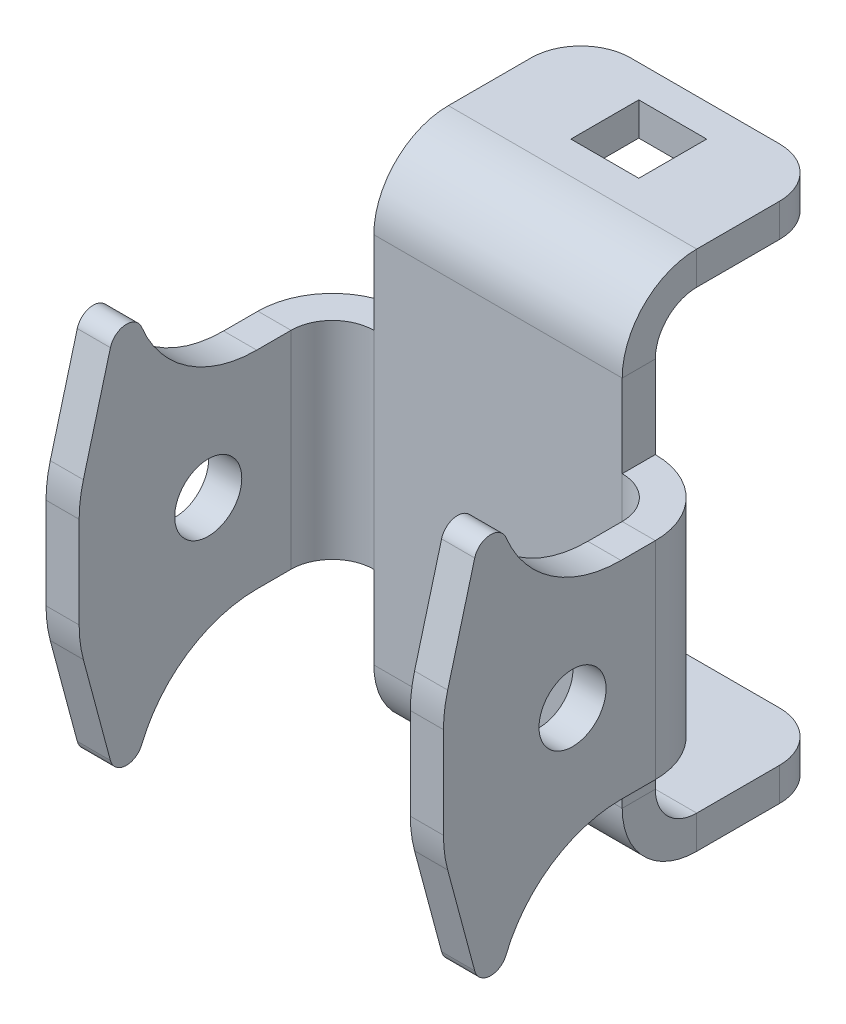
from build123d import *

# Parameters (mm, degrees)
SM_BASE_FLANGE_1_DEPTH      = 30
SM_EDGE_FLANGE_1_DEPTH      = 25
SM_EDGE_FLANGE_1_BEND_DEPTH = 25
SKETCH_10_R                 = 4.05
CUT_EXTRUDE_1_DEPTH         = 79.198465458
SKETCH_11_R                 = 4.05
CUT_EXTRUDE_2_DEPTH         = 84.054199171
FILLET_1_R                  = 6
SKETCH_12_W                 = 8.2
SKETCH_12_H                 = 8.2
CUT_EXTRUDE_3_DEPTH         = 4
SM_BASE_FLANGE_1_2_DEPTH    = 4
SM_BASE_FLANGE_2_DEPTH      = 4
FILLET_2_R                  = 15
FILLET_3_R                  = 2


# Sheet-metal steps are written as plain solids
with BuildPart() as part:
    # Sketch 1 → Sm Base Flange 1 (new body)
    with BuildSketch(Plane(origin=(0, 0, 0), x_dir=(0, 0, -1), z_dir=(1, 0, 0))):
        with BuildLine():
            Line((25, -63), (9, -63))
            ThreePointArc((9, -63), (2.636038969, -60.363961031), (0, -54))
            Line((0, -54), (0, -9))
            ThreePointArc((0, -9), (2.636038969, -2.636038969), (9, 0))
            Line((9, 0), (25, 0))
            Line((25, 0), (25, -4))
            Line((25, -4), (9, -4))
            ThreePointArc((9, -4), (5.464466094, -5.464466094), (4, -9))
            Line((4, -9), (4, -54))
            ThreePointArc((4, -54), (5.464466094, -57.535533906), (9, -59))
            Line((9, -59), (25, -59))
            Line((25, -59), (25, -63))
        make_face()
    extrude(amount=SM_BASE_FLANGE_1_DEPTH)

    # Ребро-кромка1 section (across the edge) → Ребро-кромка1 (add)
    with BuildSketch(Plane(origin=(-5, -19, 0), x_dir=(1, 0, 0), z_dir=(0, -1, 0))):
        with BuildLine():
            Line((-4, 5), (-4, 25))
            Line((-4, 25), (0, 25))
            Line((0, 25), (0, 5))
            ThreePointArc((0, 5), (1.464466094, 1.464466094), (5, 0))
            Line((5, 0), (5, -4))
            ThreePointArc((5, -4), (-1.363961031, -1.363961031), (-4, 5))
        make_face()
    extrude(amount=SM_EDGE_FLANGE_1_DEPTH)

    # Ребро-кромка1 section 2 (across the edge) → Ребро-кромка1 bend (add)
    with BuildSketch(Plane(origin=(35, -44, 0), x_dir=(-1, 0, 0), z_dir=(0, 1, 0))):
        with BuildLine():
            Line((-4, 5), (-4, 25))
            Line((-4, 25), (0, 25))
            Line((0, 25), (0, 5))
            ThreePointArc((0, 5), (1.464466094, 1.464466094), (5, 0))
            Line((5, 0), (5, -4))
            ThreePointArc((5, -4), (-1.363961031, -1.363961031), (-4, 5))
        make_face()
    extrude(amount=SM_EDGE_FLANGE_1_BEND_DEPTH)

    # Эскиз10 → Вырез-Вытянуть1 (cut, through all)
    with BuildSketch(Plane(origin=(0, 0, 0), x_dir=(1, 0, 0), z_dir=(0, 1, 0))):
        with Locations(Location((15, 17, 0), (0, 0, 270))):
            Circle(SKETCH_10_R)
    extrude(amount=-CUT_EXTRUDE_1_DEPTH, mode=Mode.SUBTRACT)

    # Эскиз11 → Вырез-Вытянуть2 (cut, through all)
    with BuildSketch(Plane(origin=(39, 0, 0), x_dir=(0, 0, -1), z_dir=(1, 0, 0))):
        with Locations((-15, -31.5)):
            Circle(SKETCH_11_R)
    extrude(amount=-CUT_EXTRUDE_2_DEPTH, mode=Mode.SUBTRACT)

    # Скругление1
    fillet_1_edges = [part.edges().sort_by_distance(p)[0] for p in [
        (0, -61, -25),
        (0, -2, -25),
        (30, -61, -25),
        (30, -2, -25),
    ]]
    fillet(fillet_1_edges, radius=FILLET_1_R)

    # Эскиз12 → Вырез-Вытянуть3 (cut)
    with BuildSketch(Plane(origin=(0, 0, 0), x_dir=(1, 0, 0), z_dir=(0, 1, 0))):
        with Locations((15, 17)):
            Rectangle(SKETCH_12_W, SKETCH_12_H)
    extrude(amount=-CUT_EXTRUDE_3_DEPTH, mode=Mode.SUBTRACT)

    # Эскиз13 → Sm Base Flange 1 2 (add)
    with BuildSketch(Plane(origin=(39, 0, 0), x_dir=(0, 0, -1), z_dir=(1, 0, 0))):
        Polygon((-25, -19), (-23.891346313, 1), (-30.590076124, -24), (-30.590076124, -39), (-23.891346313, -64), (-25, -44), align=None)
    extrude(amount=-SM_BASE_FLANGE_1_2_DEPTH)

    # Эскиз14 → Выступ2 (add)
    with BuildSketch(Plane.ZY.offset(9)):
        Polygon((25, -19), (23.891346313, 1), (30.590076124, -24), (30.590076124, -39), (23.891346313, -64), (25, -44), align=None)
    extrude(amount=-SM_BASE_FLANGE_2_DEPTH)

    # Скругление2
    fillet_2_edges = [part.edges().sort_by_distance(p)[0] for p in [
        (37, -39, 30.590076124),
        (37, -24, 30.590076124),
        (-7, -24, 30.590076124),
        (-7, -39, 30.590076124),
        (-7, -19, 25),
        (-7, -44, 25),
        (37, -44, 25),
        (37, -19, 25),
    ]]
    fillet(fillet_2_edges, radius=FILLET_2_R)

    # Скругление3
    fillet_3_edges = [part.edges().sort_by_distance(p)[0] for p in [
        (-7, -64, 23.891346313),
        (37, -64, 23.891346313),
        (37, 1, 23.891346313),
        (-7, 1, 23.891346313),
    ]]
    fillet(fillet_3_edges, radius=FILLET_3_R)


solid = part.part
